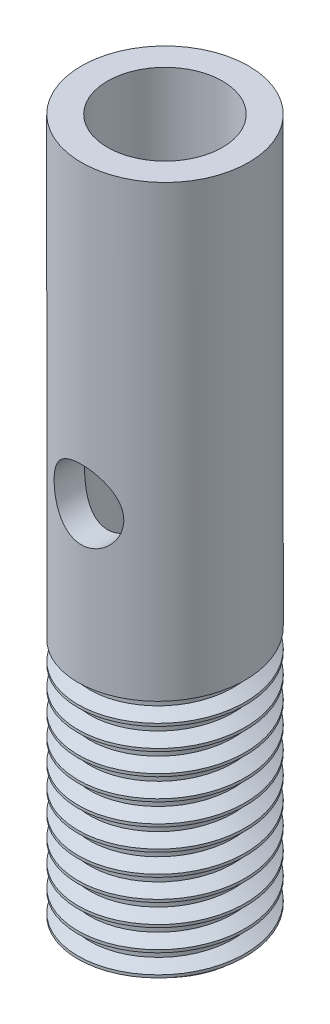
from build123d import *

# Parameters (mm, degrees)
ESQUISSE1_W                  = 1.5
ESQUISSE1_H                  = 40
FILETAGE1_PITCH              = 1.25
ENL_V_MAT_EXTRU_1_DEPTH      = 41.571911588
ENL_V_MAT_EXTRU_1_DEPTH_BACK = 41.571911588
ESQUISSE8_R                  = 2


with BuildPart() as part:
    # Esquisse1 → Révolution1 (revolve)
    with BuildSketch(Plane.XY, mode=Mode.PRIVATE) as r_volution1_sk:
        with Locations((4.05, 20)):
            Rectangle(ESQUISSE1_W, ESQUISSE1_H)
    revolve(r_volution1_sk.sketch.rotate(Axis((0, 0, 0), (0, 1, 0)), 90), axis=Axis((0, 0, 0), (0, 1, 0)))

    # Filetage1: the profile of Profil de filetage1 profile screwed along a right-hand helix of 17.6 turns, 8 arcs to a turn; built about Z, then put on its axis
    filetage1_z = Axis((0, 0, 0), (0, 0, 1))
    filetage1_corners = [(4.8003, 0, -0.000173205), (4.8003, 0, 1.093923202), (4.123417656, 0, 0.703124998), (4.123417656, 0, 0.390624998)]
    with BuildLine(mode=Mode.PRIVATE) as filetage1_profile:
        Line(filetage1_corners[0], filetage1_corners[1])
        Line(filetage1_corners[1], filetage1_corners[2])
        Line(filetage1_corners[2], filetage1_corners[3])
        Line(filetage1_corners[3], filetage1_corners[0])
    filetage1_cap = Face(filetage1_profile.wire())
    filetage1_turn_angles = [0, 22.5, 45, 67.5, 90, 112.5, 135, 157.5, 180, 202.5, 225, 247.5, 270, 292.5, 315, 337.5, 360]
    filetage1_turn_weights = [1, 0.9238795325112867, 1, 0.9238795325112867, 1, 0.9238795325112867, 1, 0.9238795325112867, 1, 0.9238795325112867, 1, 0.9238795325112867, 1, 0.9238795325112867, 1, 0.9238795325112867, 1]
    filetage1_turn_rails = [Edge.make_bspline([Vector(p[0], p[1], 0).rotate(filetage1_z, filetage1_turn_angles[k]) / filetage1_turn_weights[k] + Vector(0, 0, p[2] + FILETAGE1_PITCH * filetage1_turn_angles[k] / 360) for k in range(17)], [0, 0, 0, 1, 1, 2, 2, 3, 3, 4, 4, 5, 5, 6, 6, 7, 7, 8, 8, 8], 2, filetage1_turn_weights) for p in filetage1_corners]
    filetage1_turn_sides = [Face.make_surface_from_curves(filetage1_turn_rails[p[0]], filetage1_turn_rails[p[1]]) for p in [(0, 1), (1, 2), (2, 3), (3, 0)]]
    filetage1_last_angles = [6120, 6142.5, 6165, 6187.5, 6210, 6232.5, 6255, 6277.5, 6300, 6318, 6336]
    filetage1_last_weights = [1, 0.9238795325112867, 1, 0.9238795325112867, 1, 0.9238795325112867, 1, 0.9238795325112867, 1, 0.9510565162951535, 1]
    filetage1_last_rails = [Edge.make_bspline([Vector(p[0], p[1], 0).rotate(filetage1_z, filetage1_last_angles[k]) / filetage1_last_weights[k] + Vector(0, 0, p[2] + FILETAGE1_PITCH * filetage1_last_angles[k] / 360) for k in range(11)], [0, 0, 0, 1, 1, 2, 2, 3, 3, 4, 4, 5, 5, 5], 2, filetage1_last_weights) for p in filetage1_corners]
    filetage1_last_sides = [Face.make_surface_from_curves(filetage1_last_rails[p[0]], filetage1_last_rails[p[1]]) for p in [(0, 1), (1, 2), (2, 3), (3, 0)]]
    filetage1 = Plane(origin=(0, 15, 0), x_dir=(-1, 0, 0), z_dir=(0, -1, 0)) * Solid(Shell([*[p.moved(Location((0, 0, FILETAGE1_PITCH * i))) for i in range(17) for p in filetage1_turn_sides], *filetage1_last_sides, filetage1_cap, filetage1_cap.rotate(filetage1_z, 6336).moved(Location((0, 0, FILETAGE1_PITCH * 6336 / 360)))]))
    add(filetage1, mode=Mode.SUBTRACT)

    # Esquisse8 → Enlèv. mat.-Extru.1 (cut, two sides: drawn at the far end of the back side and taken through both)
    with BuildSketch(Plane.XY.offset(-ENL_V_MAT_EXTRU_1_DEPTH_BACK)):
        with Locations((0, 23)):
            Circle(ESQUISSE8_R)
    extrude(amount=ENL_V_MAT_EXTRU_1_DEPTH + ENL_V_MAT_EXTRU_1_DEPTH_BACK, mode=Mode.SUBTRACT)


solid = part.part
